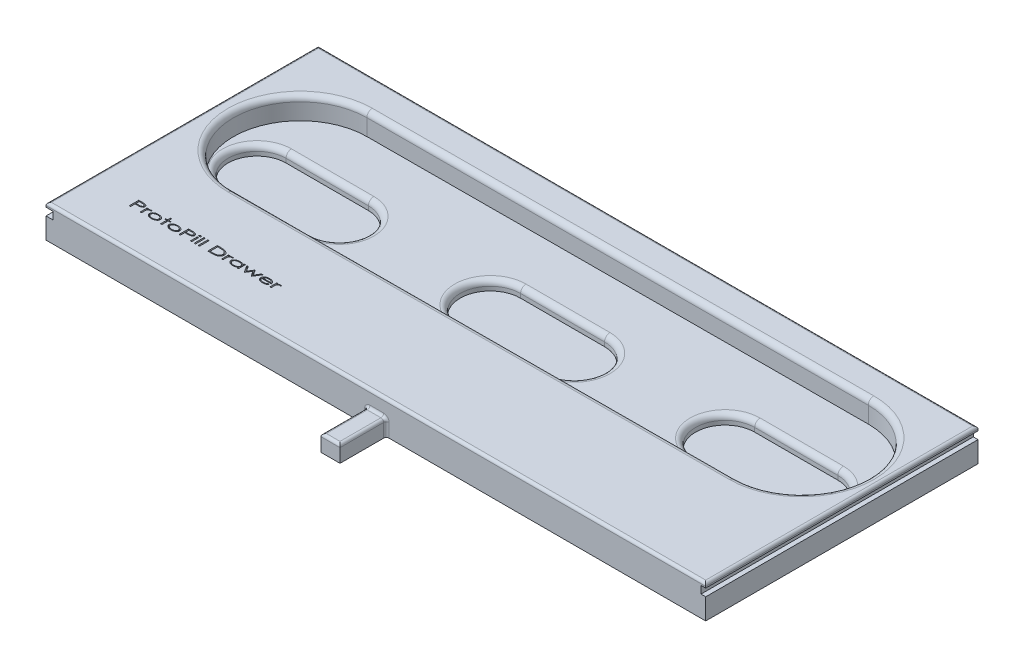
from build123d import *

# Parameters (mm, degrees)
SKETCH1_W           = 242.10193191
SKETCH1_H           = 93
BOSS_EXTRUDE1_DEPTH = 12
SKETCH2_W           = 4.694067914
SKETCH2_H           = 2.762668825
CUT_EXTRUDE1_DEPTH  = 262.694428778
SKETCH7_W           = 6.985929008
SKETCH7_H           = 5.988681595
BOSS_EXTRUDE2_DEPTH = 70
BOSS_EXTRUDE3_DEPTH = 53
CUT_EXTRUDE2_DEPTH  = 8
CUT_EXTRUDE4_DEPTH  = 3.5
FILLET2_R           = 2
FILLET3_R           = 2
SKETCH11_W          = 242.10193191
SKETCH11_H          = 46.073783244
CUT_EXTRUDE5_DEPTH  = 264.63185071
FILLET4_R           = 1
SKETCH12_R          = 3.025
CUT_EXTRUDE6_DEPTH  = 2
SKETCH13_W          = 0.493589743
SKETCH13_H          = 2.557692308
SKETCH13_H_2        = 3.58974359
CUT_EXTRUDE7_DEPTH  = 2
CUT_EXTRUDE8_DEPTH  = 2


with BuildPart() as part:
    # Sketch1 → Boss-Extrude1 (new body)
    with BuildSketch(Plane(origin=(0, 0, 0), x_dir=(1, 0, 0), z_dir=(0, 1, 0))):
        with Locations((123.266397435, 18.180222461)):
            Rectangle(SKETCH1_W, SKETCH1_H)
    extrude(amount=BOSS_EXTRUDE1_DEPTH)

    # Sketch2 → Cut-Extrude1 (cut, through all)
    with BuildSketch(Plane.XY.offset(28.319777539)):
        with Locations((2.347033957, 9.071542246)):
            Rectangle(SKETCH2_W, SKETCH2_H)
    cut_extrude1 = extrude(amount=-CUT_EXTRUDE1_DEPTH, mode=Mode.SUBTRACT)

    # Mirror5: Cut-Extrude1 across plane
    add(cut_extrude1.mirror(Plane(origin=(123.647335387, 0, 0), x_dir=(0, 0, 1), z_dir=(1, 0, 0))), mode=Mode.SUBTRACT)

    # Sketch7 → Boss-Extrude2 (add)
    with BuildSketch(Plane.XY.offset(28.319777539)):
        with Locations((123.619253178, 2.994340798)):
            Rectangle(SKETCH7_W, SKETCH7_H)
    extrude(amount=BOSS_EXTRUDE2_DEPTH)

    # Sketch8 → Boss-Extrude3 (add)
    with BuildSketch(Plane.XY.offset(28.319777539)):
        Polygon((244.31736339, 10.452876658), (244.31736339, 12), (2.21543148, 12), (2.21543148, 10.452876658), (4.694067914, 10.452876658), (4.694067914, 7.690207833), (2.21543148, 7.690207833), (2.21543148, 0), (120.126288674, 0), (120.126288674, 5.988681595), (127.112217682, 5.988681595), (127.112217682, 0), (244.31736339, 0), (244.31736339, 7.690207833), (242.60060286, 7.690207833), (242.60060286, 10.452876658), align=None)
    extrude(amount=BOSS_EXTRUDE3_DEPTH)

    # Sketch9 → Cut-Extrude2 (cut)
    with BuildSketch(Plane(origin=(0, 12, 0), x_dir=(1, 0, 0), z_dir=(0, 1, 0))):
        with BuildLine():
            Line((32.192967626, 6.462131645), (215.586098008, 7.089792499))
            ThreePointArc((215.586098008, 7.089792499), (240.21687673, -17.37296417), (215.754120062, -42.003742891))
            Line((215.754120062, -42.003742891), (32.360989679, -42.631403746))
            ThreePointArc((32.360989679, -42.631403746), (7.730210957, -18.168647077), (32.192967626, 6.462131645))
        make_face()
    extrude(amount=-CUT_EXTRUDE2_DEPTH, mode=Mode.SUBTRACT)

    # Sketch10 → Cut-Extrude4 (cut)
    with BuildSketch(Plane(origin=(0, 4, 0), x_dir=(1, 0, 0), z_dir=(0, 1, 0))):
        with BuildLine():
            Line((22.25591728, -13.271336062), (52.471076918, -13.271336062))
            ThreePointArc((52.471076918, -13.271336062), (63.102678482, -23.902937626), (52.471076918, -34.53453919))
            Line((52.471076918, -34.53453919), (22.25591728, -34.53453919))
            ThreePointArc((22.25591728, -34.53453919), (11.624315716, -23.902937626), (22.25591728, -13.271336062))
        make_face()
        with BuildLine():
            Line((108.253612411, -13.200304135), (139.069681283, -13.200304135))
            ThreePointArc((139.069681283, -13.200304135), (150.155917287, -24.286540139), (139.069681283, -35.372776144))
            Line((139.069681283, -35.372776144), (108.253612411, -35.372776144))
            ThreePointArc((108.253612411, -35.372776144), (97.167376406, -24.286540139), (108.253612411, -13.200304135))
        make_face()
        with BuildLine():
            Line((193.804446674, -12.815543396), (224.338324214, -12.815543396))
            ThreePointArc((224.338324214, -12.815543396), (235.209291929, -23.686511111), (224.338324214, -34.557478826))
            Line((224.338324214, -34.557478826), (193.804446674, -34.557478826))
            ThreePointArc((193.804446674, -34.557478826), (182.933478959, -23.686511111), (193.804446674, -12.815543396))
        make_face()
    extrude(amount=-CUT_EXTRUDE4_DEPTH, mode=Mode.SUBTRACT)

    # Fillet2
    fillet2_edges = [part.edges().sort_by_distance(p)[0] for p in [
        (240.21687673, 12, 17.37296417),
        (124.05755487, 12, 42.317573318),
        (7.730210957, 12, 18.168647077),
        (123.889532817, 12, -6.775962072),
    ]]
    fillet(fillet2_edges, radius=FILLET2_R)

    # Fillet3
    fillet3_edges = [part.edges().sort_by_distance(p)[0] for p in [
        (235.209291929, 4, 23.686511111),
        (209.071385444, 4, 34.557478826),
        (182.933478959, 4, 23.686511111),
        (150.155917287, 4, 24.286540139),
        (123.661646847, 4, 35.372776144),
        (97.167376406, 4, 24.286540139),
        (63.102678482, 4, 23.902937626),
        (37.363497099, 4, 34.53453919),
        (11.624315716, 4, 23.902937626),
        (209.071385444, 4, 12.815543396),
        (123.661646847, 4, 13.200304135),
        (37.363497099, 4, 13.271336062),
    ]]
    fillet(fillet3_edges, radius=FILLET3_R)

    # Sketch11 → Cut-Extrude5 (cut, through all)
    with BuildSketch(Plane(origin=(0, 12, 0), x_dir=(1, 0, 0), z_dir=(0, 1, 0))):
        with Locations((123.266397435, 41.643330839)):
            Rectangle(SKETCH11_W, SKETCH11_H)
    extrude(amount=-CUT_EXTRUDE5_DEPTH, mode=Mode.SUBTRACT)

    # Fillet4
    fillet4_edges = [part.edges().sort_by_distance(p)[0] for p in [
        (120.126288674, 2.994340797, 81.319777539),
        (127.112217682, 2.994340797, 81.319777539),
        (123.619253178, 5.988681595, 98.319777539),
        (120.126288674, 5.988681595, 89.819777539),
        (123.619253178, 5.988681595, 81.319777539),
        (127.112217682, 5.988681595, 89.819777539),
        (244.31736339, 12, 31.356669161),
        (123.266397435, 12, 81.319777539),
        (2.21543148, 12, 31.356669161),
        (123.266397435, 12, -18.606439217),
    ]]
    fillet(fillet4_edges, radius=FILLET4_R)

    # Sketch12 → Cut-Extrude6 (cut)
    with BuildSketch(Plane.XZ):
        with Locations((79.20490952, -2.654606068)):
            Circle(SKETCH12_R)
        with Locations((79.20490952, 6.341887825)):
            Circle(SKETCH12_R)
        with Locations((169.858472383, 5.930696377)):
            Circle(SKETCH12_R)
        with Locations((169.858472383, -2.654606068)):
            Circle(SKETCH12_R)
    extrude(amount=-CUT_EXTRUDE6_DEPTH, mode=Mode.SUBTRACT)

    # Sketch13 → Cut-Extrude7 (cut)
    # profile 1 of 16: a face of its own
    with BuildSketch(Plane(origin=(0, 12, 0), x_dir=(1, 0, 0), z_dir=(0, 1, 0))):
        with BuildLine():
            Line((18.559453652, -63.609154928), (19.589401569, -63.609154928))
            add(Edge.make_bspline(
                [(19.589401569, -63.609154928), (19.660216229, -63.609207816), (19.796009129, -63.609309233), (19.990458636, -63.612311088), (20.166922514, -63.616339403), (20.325381855, -63.621986437), (20.465916911, -63.628417575), (20.588361196, -63.637854069), (20.692806826, -63.647360425), (20.75610385, -63.657252292), (20.784814229, -63.661739063)],
                knots=[0, 0, 0, 0, 1.419177856, 2.721389515, 3.89734153, 4.956527438, 5.899121513, 6.716361902, 7.417765099, 8, 8, 8, 8], degree=3))
            add(Edge.make_bspline(
                [(20.784814229, -63.661739063), (20.820887054, -63.668358554), (20.892034872, -63.681414432), (20.995514197, -63.707401431), (21.093930167, -63.738080351), (21.187023764, -63.77418744), (21.275308065, -63.814482055), (21.358419454, -63.860319671), (21.436467741, -63.910896585), (21.509168984, -63.965877922), (21.575105371, -64.025007934), (21.632608856, -64.088601838), (21.680831646, -64.15611131), (21.721857181, -64.226827444), (21.752422367, -64.301981747), (21.774235543, -64.380809711), (21.788083956, -64.463099368), (21.789502804, -64.519389326), (21.790222883, -64.547957011)],
                knots=[0, 0, 0, 0, 1.202944546, 2.372613736, 3.497786956, 4.582770442, 5.646275108, 6.679186854, 7.693607135, 8.694962411, 9.666642172, 10.595006966, 11.501456956, 12.383984799, 13.271030618, 14.154656858, 15.063470898, 16, 16, 16, 16], degree=3))
            add(Edge.make_bspline(
                [(21.790222883, -64.547957011), (21.789521087, -64.576761689), (21.788143787, -64.633291905), (21.774119081, -64.716000476), (21.752660293, -64.794872573), (21.722045447, -64.869807261), (21.683557714, -64.941214738), (21.635074098, -65.00797268), (21.578906649, -65.07163001), (21.513310562, -65.129978091), (21.440869989, -65.18484635), (21.361600897, -65.235229344), (21.275762005, -65.280811287), (21.183647001, -65.321492741), (21.0849146, -65.357142972), (20.979859337, -65.388653778), (20.867916227, -65.415337146), (20.790732781, -65.429180671), (20.751160383, -65.436278326)],
                knots=[0, 0, 0, 0, 0.922605917, 1.810647271, 2.681294701, 3.538296812, 4.399903948, 5.275180805, 6.177331378, 7.116219832, 8.084190562, 9.088028358, 10.12368074, 11.197019002, 12.313319958, 13.4865942, 14.711362353, 16, 16, 16, 16], degree=3))
            add(Edge.make_bspline(
                [(20.751160383, -65.436278326), (20.718469229, -65.440942875), (20.646706534, -65.451182363), (20.529050496, -65.462594348), (20.392284803, -65.472278622), (20.236346099, -65.479638048), (20.061053197, -65.485869185), (19.866368667, -65.490814558), (19.65227691, -65.493557666), (19.503164369, -65.493697388), (19.425339069, -65.493770313)],
                knots=[0, 0, 0, 0, 0.596701069, 1.309861314, 2.135550679, 3.074303209, 4.130845578, 5.305332262, 6.593590277, 8, 8, 8, 8], degree=3))
            Line((19.425339069, -65.493770313), (19.053043395, -65.493770313))
            Line((19.053043395, -65.493770313), (19.053043395, -67.109154928))
            Line((19.053043395, -67.109154928), (18.559453652, -67.109154928))
            Line((18.559453652, -67.109154928), (18.559453652, -63.609154928))
        make_face()
        with BuildLine():
            Line((19.053043395, -63.968129287), (19.053043395, -65.134795954))
            Line((19.053043395, -65.134795954), (19.953984902, -65.142508294))
            add(Edge.make_bspline(
                [(19.953984902, -65.142508294), (19.99792553, -65.142521334), (20.08301808, -65.142546588), (20.205949603, -65.138570661), (20.319804463, -65.134014923), (20.424328313, -65.127165764), (20.519658494, -65.117805993), (20.606116267, -65.108019692), (20.683188352, -65.094359518), (20.772402579, -65.075649298), (20.871574629, -65.044704061), (20.978955012, -64.998076538), (21.07224247, -64.940131325), (21.152027991, -64.873727987), (21.216190155, -64.800096138), (21.262354089, -64.720428976), (21.291409318, -64.636401283), (21.294894643, -64.578326983), (21.296633139, -64.549359255)],
                knots=[0, 0, 0, 0, 1.302178146, 2.521713123, 3.644833948, 4.679186471, 5.625468095, 6.483724746, 7.256908744, 7.944332482, 9.184328887, 10.328545311, 11.404879146, 12.427406377, 13.395044434, 14.282513672, 15.143309921, 16, 16, 16, 16], degree=3))
            add(Edge.make_bspline(
                [(21.296633139, -64.549359255), (21.29488017, -64.521086999), (21.291349857, -64.464149342), (21.26214629, -64.381617706), (21.216240367, -64.302719484), (21.151826402, -64.230387849), (21.074420468, -64.163622302), (20.983396781, -64.107713567), (20.881682484, -64.060904428), (20.787456502, -64.032245262), (20.703325252, -64.013994903), (20.629883554, -64.00148467), (20.546835613, -63.991071106), (20.454427444, -63.983061843), (20.352767544, -63.975873783), (20.2417168, -63.971162183), (20.121100984, -63.968331153), (20.037420139, -63.968198302), (19.993948844, -63.968129287)],
                knots=[0, 0, 0, 0, 0.85982624, 1.731608922, 2.638175506, 3.627963027, 4.668731374, 5.743984735, 6.872385735, 8.073309669, 8.737023245, 9.49590589, 10.343247817, 11.287432573, 12.322799246, 13.449422509, 14.675002546, 16, 16, 16, 16], degree=3))
            Line((19.993948844, -63.968129287), (19.053043395, -63.968129287))
        make_face(mode=Mode.SUBTRACT)
    # profile 2 of 16: a face of its own
    with BuildSketch(Plane(origin=(0, 12, 0), x_dir=(1, 0, 0), z_dir=(0, 1, 0))):
        with BuildLine():
            Line((22.553043395, -64.55146262), (23.046633139, -64.55146262))
            Line((23.046633139, -64.55146262), (23.046633139, -64.927965024))
            add(Edge.make_bspline(
                [(23.046633139, -64.927965024), (23.082885879, -64.892621444), (23.153638365, -64.823643314), (23.268351063, -64.735386097), (23.385694455, -64.662111951), (23.506193525, -64.604249484), (23.629883275, -64.560946567), (23.755528933, -64.528912548), (23.884155021, -64.510398001), (23.970654507, -64.507865291), (24.014181216, -64.506590826)],
                knots=[0, 0, 0, 0, 1.118950737, 2.183794828, 3.193525129, 4.173720819, 5.133313879, 6.087280825, 7.037516007, 8, 8, 8, 8], degree=3))
            add(Edge.make_bspline(
                [(24.014181216, -64.506590826), (24.047897414, -64.507756469), (24.116628327, -64.510132648), (24.221300531, -64.527311932), (24.329395531, -64.554260942), (24.400953974, -64.580679867), (24.43765878, -64.59423105)],
                knots=[0, 0, 0, 0, 0.930225898, 1.896277749, 2.920927934, 4, 4, 4, 4], degree=3))
            Line((24.43765878, -64.59423105), (24.180347081, -64.866266306))
            add(Edge.make_bspline(
                [(24.180347081, -64.866266306), (24.156566026, -64.8595064), (24.111129946, -64.846590924), (24.045503081, -64.831561132), (23.985450915, -64.822594083), (23.94736645, -64.821303889), (23.929345479, -64.82069339)],
                knots=[0, 0, 0, 0, 1.159041688, 2.214464814, 3.155112748, 4, 4, 4, 4], degree=3))
            add(Edge.make_bspline(
                [(23.929345479, -64.82069339), (23.889948104, -64.822308073), (23.811047254, -64.825541788), (23.694185274, -64.85207983), (23.579705378, -64.894632173), (23.487625223, -64.943250947), (23.416756228, -64.990378929), (23.366448084, -65.031120689), (23.31903889, -65.076135863), (23.275521831, -65.126404123), (23.234924036, -65.180976511), (23.197579829, -65.240229473), (23.163881393, -65.304021263), (23.144708599, -65.348959682), (23.134974485, -65.37177512)],
                knots=[0, 0, 0, 0, 1.378395564, 2.76050325, 4.1743034, 5.645969789, 6.395007641, 7.151651941, 7.909932039, 8.681347296, 9.476827634, 10.289673222, 11.131659355, 12, 12, 12, 12], degree=3))
            add(Edge.make_bspline(
                [(23.134974485, -65.37177512), (23.127503484, -65.391971011), (23.111112, -65.436281085), (23.095135155, -65.512110019), (23.079205605, -65.601073056), (23.068303686, -65.704210737), (23.05820614, -65.820818827), (23.051559556, -65.951306742), (23.047331348, -66.095771336), (23.04687292, -66.196758208), (23.046633139, -66.249579608)],
                knots=[0, 0, 0, 0, 0.582572936, 1.278173338, 2.094113426, 3.030890954, 4.085475449, 5.26463872, 6.569263414, 8, 8, 8, 8], degree=3))
            Line((23.046633139, -66.249579608), (23.046633139, -67.109154928))
            Line((23.046633139, -67.109154928), (22.553043395, -67.109154928))
            Line((22.553043395, -67.109154928), (22.553043395, -64.55146262))
        make_face()
    # profile 3 of 16: a face of its own
    with BuildSketch(Plane(origin=(0, 12, 0), x_dir=(1, 0, 0), z_dir=(0, 1, 0))):
        with BuildLine():
            add(Edge.make_bspline(
                [(26.705787786, -64.506590826), (26.778056125, -64.507620156), (26.919621695, -64.509636499), (27.126898032, -64.530782568), (27.324628677, -64.563483241), (27.513377302, -64.608619596), (27.692408154, -64.66845597), (27.862235557, -64.74094608), (28.023182204, -64.825847595), (28.122431681, -64.894027991), (28.17183346, -64.927965024)],
                knots=[0, 0, 0, 0, 1.118029041, 2.190093497, 3.220499173, 4.217871291, 5.190012594, 6.137901036, 7.073133634, 8, 8, 8, 8], degree=3))
            add(Edge.make_bspline(
                [(28.17183346, -64.927965024), (28.213892898, -64.959851367), (28.295495735, -65.021716578), (28.402860552, -65.125435073), (28.494480251, -65.232803882), (28.5706408, -65.344323998), (28.62815826, -65.461728169), (28.670374378, -65.582809314), (28.695535165, -65.708678755), (28.698822316, -65.794207131), (28.700479293, -65.837319992)],
                knots=[0, 0, 0, 0, 1.156785325, 2.244370538, 3.266277709, 4.248660306, 5.197713603, 6.124949243, 7.054830596, 8, 8, 8, 8], degree=3))
            add(Edge.make_bspline(
                [(28.700479293, -65.837319992), (28.699020086, -65.880703477), (28.696120562, -65.966908882), (28.66788985, -66.09349869), (28.624199892, -66.21614742), (28.562685996, -66.334591252), (28.482768178, -66.448186173), (28.386329221, -66.55792718), (28.271324793, -66.662406192), (28.141405488, -66.762376644), (27.997864786, -66.85478944), (27.842118278, -66.934486584), (27.677093059, -67.00267444), (27.501834157, -67.058149076), (27.316887289, -67.10139543), (27.121923564, -67.13201863), (26.917181777, -67.150431683), (26.777341111, -67.152809862), (26.705787786, -67.154026723)],
                knots=[0, 0, 0, 0, 0.789098804, 1.567983354, 2.350210273, 3.155490411, 3.990287269, 4.874001324, 5.810856407, 6.815460693, 7.856857624, 8.915312001, 9.997439552, 11.105303834, 12.259580059, 13.453399675, 14.696961864, 16, 16, 16, 16], degree=3))
            add(Edge.make_bspline(
                [(26.705787786, -67.154026723), (26.634001021, -67.152802883), (26.493461475, -67.150406928), (26.287787586, -67.132042599), (26.092089603, -67.101519473), (25.90655601, -67.05787591), (25.730646128, -67.002978447), (25.565261375, -66.93445207), (25.409501235, -66.854798449), (25.265964077, -66.762374335), (25.136043872, -66.662406757), (25.021039664, -66.557927043), (24.924600654, -66.448186207), (24.844682849, -66.334591243), (24.783168949, -66.216147422), (24.739478992, -66.093498689), (24.71124828, -65.966908882), (24.708348756, -65.880703477), (24.706889549, -65.837319992)],
                knots=[0, 0, 0, 0, 1.305249044, 2.555333257, 3.751483921, 4.903955647, 6.018189604, 7.098625447, 8.155425126, 9.195194025, 10.198227797, 11.13361828, 12.01595081, 12.849442617, 13.653463848, 14.434467899, 15.212134806, 16, 16, 16, 16], degree=3))
            add(Edge.make_bspline(
                [(24.706889549, -65.837319992), (24.708552832, -65.794438612), (24.711861398, -65.709139906), (24.737074533, -65.583550181), (24.778871813, -65.462378766), (24.837664002, -65.346083449), (24.913193078, -65.234555112), (25.0040698, -65.126875384), (25.112150179, -65.023875406), (25.193526394, -64.962006886), (25.235535383, -64.93006839)],
                knots=[0, 0, 0, 0, 0.94172135, 1.873251586, 2.802131417, 3.750562843, 4.727561346, 5.755201045, 6.841163442, 8, 8, 8, 8], degree=3))
            add(Edge.make_bspline(
                [(25.235535383, -64.93006839), (25.284901741, -64.895839515), (25.383973083, -64.827146974), (25.545486729, -64.742381433), (25.715300151, -64.669073341), (25.89502493, -64.609467936), (26.084251711, -64.563161903), (26.28307383, -64.530923748), (26.491247685, -64.509606196), (26.633283682, -64.507609874), (26.705787786, -64.506590826)],
                knots=[0, 0, 0, 0, 0.925913955, 1.858179155, 2.807793909, 3.776850706, 4.775415181, 5.809663793, 6.881914668, 8, 8, 8, 8], degree=3))
        make_face()
        with BuildLine():
            add(Edge.make_bspline(
                [(26.703684421, -64.82069339), (26.653170058, -64.821651672), (26.553813524, -64.823536516), (26.407422979, -64.837958465), (26.266381666, -64.860892765), (26.13053942, -64.892936964), (26.000513614, -64.935200454), (25.875881416, -64.986660045), (25.756217794, -65.04679942), (25.643966715, -65.116470587), (25.540614354, -65.191698546), (25.450401465, -65.272734905), (25.373244793, -65.356884317), (25.30969161, -65.445275626), (25.26095542, -65.538352301), (25.226535498, -65.63539395), (25.204319933, -65.736059107), (25.201768787, -65.804718817), (25.200479293, -65.839423358)],
                knots=[0, 0, 0, 0, 1.211834855, 2.383553959, 3.525731113, 4.638274302, 5.728838459, 6.802447438, 7.870742288, 8.938271609, 9.968951287, 10.933831991, 11.842871365, 12.70331083, 13.538512719, 14.354385004, 15.168212155, 16, 16, 16, 16], degree=3))
            add(Edge.make_bspline(
                [(25.200479293, -65.839423358), (25.20128811, -65.861880838), (25.202903686, -65.906738615), (25.211779163, -65.973589969), (25.228617652, -66.039026504), (25.249815833, -66.103954003), (25.279245117, -66.166862968), (25.313370433, -66.229252417), (25.355453121, -66.289287174), (25.402115492, -66.348842837), (25.454227927, -66.406224097), (25.512325206, -66.459095498), (25.57354613, -66.510381481), (25.639753494, -66.557531786), (25.710618066, -66.601296414), (25.785477085, -66.641895197), (25.864869786, -66.679042672), (25.977124962, -66.724188783), (26.124887989, -66.770886307), (26.310590114, -66.810534687), (26.504322999, -66.836050577), (26.636529128, -66.838619335), (26.703684421, -66.839924159)],
                knots=[0, 0, 0, 0, 0.676698543, 1.351674039, 2.02606196, 2.70946426, 3.405653627, 4.114679009, 4.848838336, 5.610721482, 6.392982434, 7.180011484, 7.97496537, 8.797371187, 9.625630927, 10.482387151, 11.360987975, 12.264255974, 14.125429088, 16.019773843, 17.978208304, 20, 20, 20, 20], degree=3))
            add(Edge.make_bspline(
                [(26.703684421, -66.839924159), (26.770841079, -66.838623222), (26.903049896, -66.836062115), (27.096763322, -66.810490823), (27.282318068, -66.771090107), (27.429868494, -66.723812046), (27.542331492, -66.679211051), (27.621892969, -66.641887292), (27.696719417, -66.601256356), (27.767572894, -66.557792182), (27.83322779, -66.50991138), (27.895013712, -66.459355254), (27.953174172, -66.406232613), (28.005119145, -66.348566936), (28.052867782, -66.289794691), (28.093633261, -66.22875016), (28.129281063, -66.16732038), (28.157020189, -66.103563808), (28.180038595, -66.039332866), (28.194990878, -65.973378644), (28.205663819, -65.906846209), (28.206480891, -65.861902107), (28.206889549, -65.839423358)],
                knots=[0, 0, 0, 0, 2.021608502, 3.979865511, 5.874038621, 7.728335502, 8.638053201, 9.516574416, 10.373253009, 11.201437702, 12.018055674, 12.818372735, 13.605330473, 14.387520545, 15.15371191, 15.883845854, 16.596257792, 17.289495649, 17.975116066, 18.647787728, 19.323692347, 20, 20, 20, 20], degree=3))
            add(Edge.make_bspline(
                [(28.206889549, -65.839423358), (28.205604326, -65.804716578), (28.203061631, -65.736052439), (28.180783686, -65.63541998), (28.146565943, -65.538150381), (28.09683336, -65.445470458), (28.033463413, -65.356873821), (27.956213394, -65.272527733), (27.865310898, -65.191705357), (27.761397088, -65.116662108), (27.649064475, -65.046774554), (27.529379625, -64.986666237), (27.404752744, -64.935200672), (27.274727078, -64.892929588), (27.139103341, -64.860975962), (26.998549546, -64.837944566), (26.852854913, -64.82353935), (26.753964996, -64.821652671), (26.703684421, -64.82069339)],
                knots=[0, 0, 0, 0, 0.832069071, 1.646171375, 2.462319504, 3.300417048, 4.161147425, 5.070494144, 6.03988092, 7.075430977, 8.143321227, 9.211977265, 10.285949229, 11.376882104, 12.489801441, 13.626829931, 14.793361768, 16, 16, 16, 16], degree=3))
        make_face(mode=Mode.SUBTRACT)
    # profile 4 of 16: a face of its own
    with BuildSketch(Plane(origin=(0, 12, 0), x_dir=(1, 0, 0), z_dir=(0, 1, 0))):
        Polygon((30.046633139, -63.519411338), (30.540222883, -63.519411338), (30.540222883, -64.55146262), (31.303043395, -64.55146262), (31.303043395, -64.865565185), (30.540222883, -64.865565185), (30.540222883, -67.109154928), (30.046633139, -67.109154928), (30.046633139, -64.865565185), (29.373556216, -64.865565185), (29.373556216, -64.55146262), (30.046633139, -64.55146262), align=None)
    # profile 5 of 16: a face of its own
    with BuildSketch(Plane(origin=(0, 12, 0), x_dir=(1, 0, 0), z_dir=(0, 1, 0))):
        with BuildLine():
            add(Edge.make_bspline(
                [(33.840403171, -64.506590826), (33.91267151, -64.507620156), (34.054237079, -64.509636499), (34.261513416, -64.530782568), (34.459244062, -64.563483241), (34.647992687, -64.608619596), (34.827023539, -64.66845597), (34.996850942, -64.74094608), (35.157797589, -64.825847595), (35.257047065, -64.894027991), (35.306448844, -64.927965024)],
                knots=[0, 0, 0, 0, 1.118029041, 2.190093497, 3.220499173, 4.217871291, 5.190012594, 6.137901036, 7.073133634, 8, 8, 8, 8], degree=3))
            add(Edge.make_bspline(
                [(35.306448844, -64.927965024), (35.348508282, -64.959851367), (35.430111119, -65.021716578), (35.537475937, -65.125435073), (35.629095636, -65.232803882), (35.705256185, -65.344323998), (35.762773644, -65.461728169), (35.804989762, -65.582809314), (35.83015055, -65.708678755), (35.833437701, -65.794207131), (35.835094678, -65.837319992)],
                knots=[0, 0, 0, 0, 1.156785325, 2.244370538, 3.266277709, 4.248660306, 5.197713603, 6.124949243, 7.054830596, 8, 8, 8, 8], degree=3))
            add(Edge.make_bspline(
                [(35.835094678, -65.837319992), (35.833635471, -65.880703477), (35.830735946, -65.966908882), (35.802505235, -66.09349869), (35.758815277, -66.21614742), (35.697301381, -66.334591252), (35.617383562, -66.448186173), (35.520944606, -66.55792718), (35.405940177, -66.662406192), (35.276020873, -66.762376644), (35.13248017, -66.85478944), (34.976733663, -66.934486584), (34.811708444, -67.00267444), (34.636449541, -67.058149076), (34.451502674, -67.10139543), (34.256538949, -67.13201863), (34.051797161, -67.150431683), (33.911956496, -67.152809862), (33.840403171, -67.154026723)],
                knots=[0, 0, 0, 0, 0.789098804, 1.567983354, 2.350210273, 3.155490411, 3.990287269, 4.874001324, 5.810856407, 6.815460693, 7.856857624, 8.915312001, 9.997439552, 11.105303834, 12.259580059, 13.453399675, 14.696961864, 16, 16, 16, 16], degree=3))
            add(Edge.make_bspline(
                [(33.840403171, -67.154026723), (33.768616406, -67.152802883), (33.62807686, -67.150406928), (33.422402971, -67.132042599), (33.226704988, -67.101519473), (33.041171394, -67.05787591), (32.865261513, -67.002978447), (32.699876759, -66.93445207), (32.544116619, -66.854798449), (32.400579462, -66.762374335), (32.270659257, -66.662406757), (32.155655049, -66.557927043), (32.059216039, -66.448186207), (31.979298233, -66.334591243), (31.917784334, -66.216147422), (31.874094377, -66.093498689), (31.845863665, -65.966908882), (31.84296414, -65.880703477), (31.841504934, -65.837319992)],
                knots=[0, 0, 0, 0, 1.305249044, 2.555333257, 3.751483921, 4.903955647, 6.018189604, 7.098625447, 8.155425126, 9.195194025, 10.198227797, 11.13361828, 12.01595081, 12.849442617, 13.653463848, 14.434467899, 15.212134806, 16, 16, 16, 16], degree=3))
            add(Edge.make_bspline(
                [(31.841504934, -65.837319992), (31.843168217, -65.794438612), (31.846476782, -65.709139906), (31.871689918, -65.583550181), (31.913487198, -65.462378766), (31.972279386, -65.346083449), (32.047808463, -65.234555112), (32.138685185, -65.126875384), (32.246765564, -65.023875406), (32.328141779, -64.962006886), (32.370150767, -64.93006839)],
                knots=[0, 0, 0, 0, 0.94172135, 1.873251586, 2.802131417, 3.750562843, 4.727561346, 5.755201045, 6.841163442, 8, 8, 8, 8], degree=3))
            add(Edge.make_bspline(
                [(32.370150767, -64.93006839), (32.419517126, -64.895839515), (32.518588467, -64.827146974), (32.680102113, -64.742381433), (32.849915535, -64.669073341), (33.029640315, -64.609467936), (33.218867096, -64.563161903), (33.417689214, -64.530923748), (33.62586307, -64.509606196), (33.767899067, -64.507609874), (33.840403171, -64.506590826)],
                knots=[0, 0, 0, 0, 0.925913955, 1.858179155, 2.807793909, 3.776850706, 4.775415181, 5.809663793, 6.881914668, 8, 8, 8, 8], degree=3))
        make_face()
        with BuildLine():
            add(Edge.make_bspline(
                [(33.838299806, -64.82069339), (33.787785443, -64.821651672), (33.688428909, -64.823536516), (33.542038364, -64.837958465), (33.400997051, -64.860892765), (33.265154804, -64.892936964), (33.135128999, -64.935200454), (33.010496801, -64.986660045), (32.890833179, -65.04679942), (32.7785821, -65.116470587), (32.675229739, -65.191698546), (32.585016849, -65.272734905), (32.507860177, -65.356884317), (32.444306995, -65.445275626), (32.395570804, -65.538352301), (32.361150883, -65.63539395), (32.338935317, -65.736059107), (32.336384172, -65.804718817), (32.335094678, -65.839423358)],
                knots=[0, 0, 0, 0, 1.211834855, 2.383553959, 3.525731113, 4.638274302, 5.728838459, 6.802447438, 7.870742288, 8.938271609, 9.968951287, 10.933831991, 11.842871365, 12.70331083, 13.538512719, 14.354385004, 15.168212155, 16, 16, 16, 16], degree=3))
            add(Edge.make_bspline(
                [(32.335094678, -65.839423358), (32.335903495, -65.861880838), (32.337519071, -65.906738615), (32.346394547, -65.973589969), (32.363233036, -66.039026504), (32.384431218, -66.103954003), (32.413860502, -66.166862968), (32.447985817, -66.229252417), (32.490068505, -66.289287174), (32.536730877, -66.348842837), (32.588843311, -66.406224097), (32.646940591, -66.459095498), (32.708161514, -66.510381481), (32.774368878, -66.557531786), (32.84523345, -66.601296414), (32.920092469, -66.641895197), (32.999485171, -66.679042672), (33.111740347, -66.724188783), (33.259503373, -66.770886307), (33.445205499, -66.810534687), (33.638938383, -66.836050577), (33.771144513, -66.838619335), (33.838299806, -66.839924159)],
                knots=[0, 0, 0, 0, 0.676698543, 1.351674039, 2.02606196, 2.70946426, 3.405653627, 4.114679009, 4.848838336, 5.610721482, 6.392982434, 7.180011484, 7.97496537, 8.797371187, 9.625630927, 10.482387151, 11.360987975, 12.264255974, 14.125429088, 16.019773843, 17.978208304, 20, 20, 20, 20], degree=3))
            add(Edge.make_bspline(
                [(33.838299806, -66.839924159), (33.905456464, -66.838623222), (34.03766528, -66.836062115), (34.231378706, -66.810490823), (34.416933453, -66.771090107), (34.564483879, -66.723812046), (34.676946876, -66.679211051), (34.756508354, -66.641887292), (34.831334801, -66.601256356), (34.902188279, -66.557792182), (34.967843174, -66.50991138), (35.029629097, -66.459355254), (35.087789556, -66.406232613), (35.13973453, -66.348566936), (35.187483167, -66.289794691), (35.228248646, -66.22875016), (35.263896448, -66.16732038), (35.291635574, -66.103563808), (35.314653979, -66.039332866), (35.329606263, -65.973378644), (35.340279203, -65.906846209), (35.341096276, -65.861902107), (35.341504934, -65.839423358)],
                knots=[0, 0, 0, 0, 2.021608502, 3.979865511, 5.874038621, 7.728335502, 8.638053201, 9.516574416, 10.373253009, 11.201437702, 12.018055674, 12.818372735, 13.605330473, 14.387520545, 15.15371191, 15.883845854, 16.596257792, 17.289495649, 17.975116066, 18.647787728, 19.323692347, 20, 20, 20, 20], degree=3))
            add(Edge.make_bspline(
                [(35.341504934, -65.839423358), (35.340219711, -65.804716578), (35.337677016, -65.736052439), (35.31539907, -65.63541998), (35.281181328, -65.538150381), (35.231448744, -65.445470458), (35.168078797, -65.356873821), (35.090828779, -65.272527733), (34.999926282, -65.191705357), (34.896012472, -65.116662108), (34.78367986, -65.046774554), (34.663995009, -64.986666237), (34.539368128, -64.935200672), (34.409342463, -64.892929588), (34.273718725, -64.860975962), (34.133164931, -64.837944566), (33.987470297, -64.82353935), (33.88858038, -64.821652671), (33.838299806, -64.82069339)],
                knots=[0, 0, 0, 0, 0.832069071, 1.646171375, 2.462319504, 3.300417048, 4.161147425, 5.070494144, 6.03988092, 7.075430977, 8.143321227, 9.211977265, 10.285949229, 11.376882104, 12.489801441, 13.626829931, 14.793361768, 16, 16, 16, 16], degree=3))
        make_face(mode=Mode.SUBTRACT)
    # profile 6 of 16: a face of its own
    with BuildSketch(Plane(origin=(0, 12, 0), x_dir=(1, 0, 0), z_dir=(0, 1, 0))):
        with BuildLine():
            Line((36.822274165, -63.609154928), (37.852222081, -63.609154928))
            add(Edge.make_bspline(
                [(37.852222081, -63.609154928), (37.923036742, -63.609207816), (38.058829642, -63.609309233), (38.253279149, -63.612311088), (38.429743027, -63.616339403), (38.588202368, -63.621986437), (38.728737424, -63.628417575), (38.851181709, -63.637854069), (38.955627339, -63.647360425), (39.018924363, -63.657252292), (39.047634742, -63.661739063)],
                knots=[0, 0, 0, 0, 1.419177856, 2.721389515, 3.89734153, 4.956527438, 5.899121513, 6.716361902, 7.417765099, 8, 8, 8, 8], degree=3))
            add(Edge.make_bspline(
                [(39.047634742, -63.661739063), (39.083707567, -63.668358554), (39.154855385, -63.681414432), (39.25833471, -63.707401431), (39.35675068, -63.738080351), (39.449844277, -63.77418744), (39.538128578, -63.814482055), (39.621239966, -63.860319671), (39.699288254, -63.910896585), (39.771989497, -63.965877922), (39.837925884, -64.025007934), (39.895429369, -64.088601838), (39.943652158, -64.15611131), (39.984677694, -64.226827444), (40.01524288, -64.301981747), (40.037056055, -64.380809711), (40.050904469, -64.463099368), (40.052323317, -64.519389326), (40.053043395, -64.547957011)],
                knots=[0, 0, 0, 0, 1.202944546, 2.372613736, 3.497786956, 4.582770442, 5.646275108, 6.679186854, 7.693607135, 8.694962411, 9.666642172, 10.595006966, 11.501456956, 12.383984799, 13.271030618, 14.154656858, 15.063470898, 16, 16, 16, 16], degree=3))
            add(Edge.make_bspline(
                [(40.053043395, -64.547957011), (40.0523416, -64.576761689), (40.0509643, -64.633291905), (40.036939593, -64.716000476), (40.015480806, -64.794872573), (39.984865959, -64.869807261), (39.946378227, -64.941214738), (39.897894611, -65.00797268), (39.841727161, -65.07163001), (39.776131075, -65.129978091), (39.703690502, -65.18484635), (39.62442141, -65.235229344), (39.538582518, -65.280811287), (39.446467514, -65.321492741), (39.347735113, -65.357142972), (39.24267985, -65.388653778), (39.130736739, -65.415337146), (39.053553293, -65.429180671), (39.013980895, -65.436278326)],
                knots=[0, 0, 0, 0, 0.922605917, 1.810647271, 2.681294701, 3.538296812, 4.399903948, 5.275180805, 6.177331378, 7.116219832, 8.084190562, 9.088028358, 10.12368074, 11.197019002, 12.313319958, 13.4865942, 14.711362353, 16, 16, 16, 16], degree=3))
            add(Edge.make_bspline(
                [(39.013980895, -65.436278326), (38.981289742, -65.440942875), (38.909527047, -65.451182363), (38.791871009, -65.462594348), (38.655105316, -65.472278622), (38.499166612, -65.479638048), (38.32387371, -65.485869185), (38.12918918, -65.490814558), (37.915097422, -65.493557666), (37.765984882, -65.493697388), (37.688159581, -65.493770313)],
                knots=[0, 0, 0, 0, 0.596701069, 1.309861314, 2.135550679, 3.074303209, 4.130845578, 5.305332262, 6.593590277, 8, 8, 8, 8], degree=3))
            Line((37.688159581, -65.493770313), (37.315863908, -65.493770313))
            Line((37.315863908, -65.493770313), (37.315863908, -67.109154928))
            Line((37.315863908, -67.109154928), (36.822274165, -67.109154928))
            Line((36.822274165, -67.109154928), (36.822274165, -63.609154928))
        make_face()
        with BuildLine():
            Line((37.315863908, -63.968129287), (37.315863908, -65.134795954))
            Line((37.315863908, -65.134795954), (38.216805415, -65.142508294))
            add(Edge.make_bspline(
                [(38.216805415, -65.142508294), (38.260746043, -65.142521334), (38.345838593, -65.142546588), (38.468770116, -65.138570661), (38.582624975, -65.134014923), (38.687148826, -65.127165764), (38.782479007, -65.117805993), (38.86893678, -65.108019692), (38.946008865, -65.094359518), (39.035223092, -65.075649298), (39.134395142, -65.044704061), (39.241775524, -64.998076538), (39.335062983, -64.940131325), (39.414848504, -64.873727987), (39.479010668, -64.800096138), (39.525174602, -64.720428976), (39.554229831, -64.636401283), (39.557715156, -64.578326983), (39.559453652, -64.549359255)],
                knots=[0, 0, 0, 0, 1.302178146, 2.521713123, 3.644833948, 4.679186471, 5.625468095, 6.483724746, 7.256908744, 7.944332482, 9.184328887, 10.328545311, 11.404879146, 12.427406377, 13.395044434, 14.282513672, 15.143309921, 16, 16, 16, 16], degree=3))
            add(Edge.make_bspline(
                [(39.559453652, -64.549359255), (39.557700683, -64.521086999), (39.554170369, -64.464149342), (39.524966803, -64.381617706), (39.47906088, -64.302719484), (39.414646915, -64.230387849), (39.337240981, -64.163622302), (39.246217293, -64.107713567), (39.144502997, -64.060904428), (39.050277015, -64.032245262), (38.966145765, -64.013994903), (38.892704067, -64.00148467), (38.809656126, -63.991071106), (38.717247957, -63.983061843), (38.615588056, -63.975873783), (38.504537313, -63.971162183), (38.383921497, -63.968331153), (38.300240652, -63.968198302), (38.256769357, -63.968129287)],
                knots=[0, 0, 0, 0, 0.85982624, 1.731608922, 2.638175506, 3.627963027, 4.668731374, 5.743984735, 6.872385735, 8.073309669, 8.737023245, 9.49590589, 10.343247817, 11.287432573, 12.322799246, 13.449422509, 14.675002546, 16, 16, 16, 16], degree=3))
            Line((38.256769357, -63.968129287), (37.315863908, -63.968129287))
        make_face(mode=Mode.SUBTRACT)
    # profile 7 of 16: a face of its own
    with BuildSketch(Plane(origin=(0, 12, 0), x_dir=(1, 0, 0), z_dir=(0, 1, 0))):
        with BuildLine():
            add(Edge.make_bspline(
                [(41.195170799, -63.474539544), (41.223742293, -63.475444808), (41.279186456, -63.47720151), (41.359164795, -63.491819245), (41.432178837, -63.517540909), (41.497355041, -63.551134641), (41.552523123, -63.591527922), (41.592788877, -63.638471284), (41.619361021, -63.690084533), (41.622163424, -63.7268835), (41.623556216, -63.745172556)],
                knots=[0, 0, 0, 0, 1.232622349, 2.391954591, 3.492533549, 4.561789548, 5.54829387, 6.421376584, 7.215425493, 8, 8, 8, 8], degree=3))
            add(Edge.make_bspline(
                [(41.623556216, -63.745172556), (41.622129336, -63.762989159), (41.619237592, -63.79909666), (41.592764511, -63.849828547), (41.552271135, -63.896017197), (41.497388245, -63.936437233), (41.43216936, -63.969990798), (41.359167501, -63.995723927), (41.279185714, -64.010338417), (41.22374204, -64.01209558), (41.195170799, -64.013001082)],
                knots=[0, 0, 0, 0, 0.768134372, 1.55671721, 2.426123539, 3.417176527, 4.491362752, 5.597016362, 6.761694161, 8, 8, 8, 8], degree=3))
            add(Edge.make_bspline(
                [(41.195170799, -64.013001082), (41.167299701, -64.012088189), (41.113015682, -64.010310165), (41.034441435, -63.995641492), (40.962203204, -63.969837117), (40.897154989, -63.936450047), (40.842278337, -63.896014323), (40.80178356, -63.849829196), (40.775310798, -63.799096509), (40.772419013, -63.762989109), (40.770992113, -63.745172556)],
                knots=[0, 0, 0, 0, 1.217058856, 2.370442829, 3.474794704, 4.557074952, 5.555595552, 6.431552882, 7.226077714, 8, 8, 8, 8], degree=3))
            add(Edge.make_bspline(
                [(40.770992113, -63.745172556), (40.772384926, -63.726883552), (40.77518737, -63.690084689), (40.801759191, -63.638470624), (40.842026358, -63.59153082), (40.897188205, -63.551121842), (40.962193812, -63.517694669), (41.034444082, -63.491901625), (41.113014965, -63.477229785), (41.167299458, -63.475452207), (41.195170799, -63.474539544)],
                knots=[0, 0, 0, 0, 0.790458961, 1.590463383, 2.470094379, 3.463997666, 4.541273283, 5.640518464, 6.788569012, 8, 8, 8, 8], degree=3))
        make_face()
    # profile 8 of 16: a face of its own
    with BuildSketch(Plane(origin=(0, 12, 0), x_dir=(1, 0, 0), z_dir=(0, 1, 0))):
        with Locations((41.197274165, -65.830308774)):
            Rectangle(SKETCH13_W, SKETCH13_H)
    # profile 9 of 16: a face of its own
    with BuildSketch(Plane(origin=(0, 12, 0), x_dir=(1, 0, 0), z_dir=(0, 1, 0))):
        with Locations((42.633171601, -65.314283133)):
            Rectangle(SKETCH13_W, SKETCH13_H_2)
    # profile 10 of 16: a face of its own
    with BuildSketch(Plane(origin=(0, 12, 0), x_dir=(1, 0, 0), z_dir=(0, 1, 0))):
        with Locations((44.069069037, -65.314283133)):
            Rectangle(SKETCH13_W, SKETCH13_H_2)
    # profile 11 of 16: a face of its own
    with BuildSketch(Plane(origin=(0, 12, 0), x_dir=(1, 0, 0), z_dir=(0, 1, 0))):
        with BuildLine():
            Line((47.36714596, -67.109154928), (47.36714596, -63.609154928))
            Line((47.36714596, -63.609154928), (48.438460062, -63.609154928))
            add(Edge.make_bspline(
                [(48.438460062, -63.609154928), (48.531712009, -63.609594491), (48.711689613, -63.610442853), (48.971851243, -63.615895212), (49.212171661, -63.625396635), (49.432590558, -63.639513457), (49.633032827, -63.656451712), (49.813573226, -63.678081235), (49.974404016, -63.703247199), (50.074263118, -63.725097127), (50.12115237, -63.735356851)],
                knots=[0, 0, 0, 0, 1.323813521, 2.554979188, 3.693909684, 4.737789415, 5.690279757, 6.54911815, 7.318732465, 8, 8, 8, 8], degree=3))
            add(Edge.make_bspline(
                [(50.12115237, -63.735356851), (50.182360785, -63.750727059), (50.302289439, -63.780842662), (50.47510584, -63.837934848), (50.63743565, -63.903410911), (50.790380521, -63.975703775), (50.931875258, -64.058538865), (51.064820416, -64.147100164), (51.186111181, -64.245737983), (51.297114502, -64.351616929), (51.396649223, -64.463823474), (51.482778392, -64.582568992), (51.556053676, -64.706153808), (51.616102467, -64.835272179), (51.66268865, -64.96989436), (51.695126289, -65.109985297), (51.716599116, -65.254959753), (51.718664648, -65.353468165), (51.719710062, -65.403325601)],
                knots=[0, 0, 0, 0, 1.207798654, 2.366499211, 3.480576359, 4.557146755, 5.601517647, 6.616536575, 7.612203728, 8.589979544, 9.55040618, 10.479294148, 11.393893687, 12.296620384, 13.200709655, 14.115506133, 15.04621312, 16, 16, 16, 16], degree=3))
            add(Edge.make_bspline(
                [(51.719710062, -65.403325601), (51.71893028, -65.44662001), (51.717390347, -65.532118874), (51.70024112, -65.657973096), (51.674873544, -65.780195858), (51.637216344, -65.898018322), (51.590084674, -66.012342778), (51.53255743, -66.122909801), (51.463341196, -66.228750322), (51.38472431, -66.330215054), (51.298266291, -66.426557074), (51.204295017, -66.516438037), (51.105296567, -66.600746353), (50.998948774, -66.677434843), (50.887067496, -66.74843722), (50.768192025, -66.811937669), (50.643543087, -66.869819765), (50.511351032, -66.921417693), (50.369248869, -66.966514904), (50.214925451, -67.005008441), (50.047228204, -67.036725523), (49.865936723, -67.063218635), (49.671362091, -67.084174925), (49.463202803, -67.098401362), (49.241800204, -67.107872409), (49.089579057, -67.108719292), (49.011276569, -67.109154928)],
                knots=[0, 0, 0, 0, 0.867583375, 1.713324997, 2.542387203, 3.367932116, 4.189477015, 5.019531976, 5.863128609, 6.721742731, 7.591172003, 8.456207664, 9.327453716, 10.196390289, 11.083089667, 11.982588127, 12.896750361, 13.837492442, 14.826032314, 15.884199514, 17.024778466, 18.246884326, 19.557235698, 20.947863052, 22.429982155, 24, 24, 24, 24], degree=3))
            Line((49.011276569, -67.109154928), (47.36714596, -67.109154928))
        make_face()
        with BuildLine():
            Line((47.860735703, -66.750180569), (48.463700447, -66.750180569))
            add(Edge.make_bspline(
                [(48.463700447, -66.750180569), (48.550407656, -66.749934964), (48.716821888, -66.749463582), (48.95616186, -66.745259824), (49.174708879, -66.738427089), (49.37271188, -66.728874591), (49.549883598, -66.71619384), (49.706396613, -66.702106612), (49.842167294, -66.684499735), (49.925133013, -66.668512174), (49.963399966, -66.661138101)],
                knots=[0, 0, 0, 0, 1.383279688, 2.654882197, 3.818759855, 4.871481191, 5.817166586, 6.652292251, 7.378385793, 8, 8, 8, 8], degree=3))
            add(Edge.make_bspline(
                [(49.963399966, -66.661138101), (50.011186753, -66.649900503), (50.105041787, -66.62782944), (50.241009103, -66.587803159), (50.36838981, -66.539255854), (50.488739138, -66.486822737), (50.600589123, -66.425799165), (50.70498325, -66.359779234), (50.801333549, -66.286791684), (50.889427588, -66.207922208), (50.968761515, -66.123588853), (51.03706997, -66.033750412), (51.095875592, -65.940178438), (51.144034391, -65.841593247), (51.180096557, -65.737828321), (51.207238232, -65.63024341), (51.222644147, -65.51781855), (51.224948247, -65.441464821), (51.226120319, -65.402624479)],
                knots=[0, 0, 0, 0, 1.213921113, 2.384186417, 3.50166985, 4.583183161, 5.627935832, 6.649229357, 7.63522774, 8.613403315, 9.570260051, 10.49386413, 11.399942308, 12.29947164, 13.200651912, 14.111784984, 15.039484809, 16, 16, 16, 16], degree=3))
            add(Edge.make_bspline(
                [(51.226120319, -65.402624479), (51.225164489, -65.361653507), (51.223281928, -65.280958781), (51.204746311, -65.162709599), (51.177133933, -65.048797063), (51.136823711, -64.939456945), (51.084560482, -64.834968598), (51.021777525, -64.734416325), (50.947039959, -64.639039909), (50.861283864, -64.54852776), (50.765322475, -64.46414008), (50.660407906, -64.385833697), (50.546112391, -64.315173186), (50.423418459, -64.250271267), (50.290797228, -64.193980968), (50.149854108, -64.143152042), (49.999496542, -64.100679796), (49.89575075, -64.077907524), (49.842807017, -64.066286338)],
                knots=[0, 0, 0, 0, 0.937479559, 1.846420823, 2.734195072, 3.61797647, 4.508263293, 5.405088182, 6.327834881, 7.277997599, 8.256154844, 9.250457072, 10.272077141, 11.330106498, 12.425583743, 13.568150063, 14.758974123, 16, 16, 16, 16], degree=3))
            add(Edge.make_bspline(
                [(49.842807017, -64.066286338), (49.798702837, -64.058152015), (49.704301647, -64.040741196), (49.551849118, -64.022169849), (49.38002734, -64.005402586), (49.18833763, -63.991414461), (48.976757528, -63.981340846), (48.74536129, -63.973768644), (48.494105175, -63.968655685), (48.319973182, -63.968309238), (48.229525767, -63.968129287)],
                knots=[0, 0, 0, 0, 0.664968389, 1.423307427, 2.276521454, 3.225252385, 4.273249474, 5.41763715, 6.658672415, 8, 8, 8, 8], degree=3))
            Line((48.229525767, -63.968129287), (47.860735703, -63.968129287))
            Line((47.860735703, -63.968129287), (47.860735703, -66.750180569))
        make_face(mode=Mode.SUBTRACT)
    # profile 12 of 16: a face of its own
    with BuildSketch(Plane(origin=(0, 12, 0), x_dir=(1, 0, 0), z_dir=(0, 1, 0))):
        with BuildLine():
            Line((52.43765878, -64.55146262), (52.931248524, -64.55146262))
            Line((52.931248524, -64.55146262), (52.931248524, -64.927965024))
            add(Edge.make_bspline(
                [(52.931248524, -64.927965024), (52.967501264, -64.892621444), (53.03825375, -64.823643314), (53.152966447, -64.735386097), (53.270309839, -64.662111951), (53.39080891, -64.604249484), (53.51449866, -64.560946567), (53.640144318, -64.528912548), (53.768770406, -64.510398001), (53.855269892, -64.507865291), (53.898796601, -64.506590826)],
                knots=[0, 0, 0, 0, 1.118950737, 2.183794828, 3.193525129, 4.173720819, 5.133313879, 6.087280825, 7.037516007, 8, 8, 8, 8], degree=3))
            add(Edge.make_bspline(
                [(53.898796601, -64.506590826), (53.932512798, -64.507756469), (54.001243711, -64.510132648), (54.105915916, -64.527311932), (54.214010916, -64.554260942), (54.285569359, -64.580679867), (54.322274165, -64.59423105)],
                knots=[0, 0, 0, 0, 0.930225898, 1.896277749, 2.920927934, 4, 4, 4, 4], degree=3))
            Line((54.322274165, -64.59423105), (54.064962466, -64.866266306))
            add(Edge.make_bspline(
                [(54.064962466, -64.866266306), (54.04118141, -64.8595064), (53.99574533, -64.846590924), (53.930118466, -64.831561132), (53.8700663, -64.822594083), (53.831981835, -64.821303889), (53.813960863, -64.82069339)],
                knots=[0, 0, 0, 0, 1.159041688, 2.214464814, 3.155112748, 4, 4, 4, 4], degree=3))
            add(Edge.make_bspline(
                [(53.813960863, -64.82069339), (53.774563489, -64.822308073), (53.695662639, -64.825541788), (53.578800659, -64.85207983), (53.464320762, -64.894632173), (53.372240607, -64.943250947), (53.301371612, -64.990378929), (53.251063469, -65.031120689), (53.203654275, -65.076135863), (53.160137216, -65.126404123), (53.119539421, -65.180976511), (53.082195214, -65.240229473), (53.048496778, -65.304021263), (53.029323984, -65.348959682), (53.01958987, -65.37177512)],
                knots=[0, 0, 0, 0, 1.378395564, 2.76050325, 4.1743034, 5.645969789, 6.395007641, 7.151651941, 7.909932039, 8.681347296, 9.476827634, 10.289673222, 11.131659355, 12, 12, 12, 12], degree=3))
            add(Edge.make_bspline(
                [(53.01958987, -65.37177512), (53.012118868, -65.391971011), (52.995727384, -65.436281085), (52.97975054, -65.512110019), (52.963820989, -65.601073056), (52.952919071, -65.704210737), (52.942821525, -65.820818827), (52.936174941, -65.951306742), (52.931946732, -66.095771336), (52.931488305, -66.196758208), (52.931248524, -66.249579608)],
                knots=[0, 0, 0, 0, 0.582572936, 1.278173338, 2.094113426, 3.030890954, 4.085475449, 5.26463872, 6.569263414, 8, 8, 8, 8], degree=3))
            Line((52.931248524, -66.249579608), (52.931248524, -67.109154928))
            Line((52.931248524, -67.109154928), (52.43765878, -67.109154928))
            Line((52.43765878, -67.109154928), (52.43765878, -64.55146262))
        make_face()
    # profile 13 of 16: a face of its own
    with BuildSketch(Plane(origin=(0, 12, 0), x_dir=(1, 0, 0), z_dir=(0, 1, 0))):
        with BuildLine():
            Line((58.629966472, -64.55146262), (58.629966472, -67.109154928))
            Line((58.629966472, -67.109154928), (58.136376729, -67.109154928))
            Line((58.136376729, -67.109154928), (58.136376729, -66.666747076))
            add(Edge.make_bspline(
                [(58.136376729, -66.666747076), (58.083405025, -66.707144972), (57.977740519, -66.787728067), (57.80516538, -66.888334084), (57.623576286, -66.973052459), (57.432019869, -67.040222741), (57.23150627, -67.091139072), (57.022160476, -67.127216323), (56.803840868, -67.150570325), (56.654967572, -67.152860788), (56.579185222, -67.154026723)],
                knots=[0, 0, 0, 0, 0.959950057, 1.9148459, 2.87384884, 3.846004085, 4.837560737, 5.853778905, 6.907489231, 8, 8, 8, 8], degree=3))
            add(Edge.make_bspline(
                [(56.579185222, -67.154026723), (56.511834357, -67.15281249), (56.379452071, -67.150425841), (56.184595544, -67.131673367), (55.997367817, -67.101949123), (55.817336407, -67.059734305), (55.644987842, -67.005276263), (55.480074165, -66.9381943), (55.322411488, -66.859814105), (55.174528406, -66.769213218), (55.038813222, -66.671014904), (54.919093167, -66.566671181), (54.818569116, -66.455680116), (54.735700408, -66.339672541), (54.671016296, -66.218093368), (54.625010515, -66.09118191), (54.596619229, -65.95893555), (54.593219728, -65.868776207), (54.591504934, -65.823297556)],
                knots=[0, 0, 0, 0, 1.226021397, 2.409820796, 3.560528837, 4.675169253, 5.773241012, 6.84782229, 7.91342823, 8.975196037, 10.001589918, 10.960246305, 11.860978357, 12.721634312, 13.549600474, 14.359895992, 15.172690086, 16, 16, 16, 16], degree=3))
            add(Edge.make_bspline(
                [(54.591504934, -65.823297556), (54.593250564, -65.77875867), (54.596720224, -65.690232002), (54.624839457, -65.560131313), (54.671970306, -65.435271195), (54.737055308, -65.315614638), (54.820162251, -65.200830653), (54.922486921, -65.091848358), (55.042735011, -64.987633697), (55.179593468, -64.889779885), (55.32894941, -64.80019106), (55.487797498, -64.721723646), (55.653795233, -64.654555584), (55.827808982, -64.60104822), (56.008748713, -64.55793434), (56.197417144, -64.528002604), (56.393285918, -64.510456485), (56.526331604, -64.507892922), (56.59390878, -64.506590826)],
                knots=[0, 0, 0, 0, 0.810112008, 1.610200051, 2.409779071, 3.23202922, 4.082076825, 4.982045036, 5.946842608, 6.973913408, 8.040473165, 9.113409892, 10.195590852, 11.296150651, 12.423889662, 13.578489405, 14.770055223, 16, 16, 16, 16], degree=3))
            add(Edge.make_bspline(
                [(56.59390878, -64.506590826), (56.671553579, -64.508040068), (56.823694877, -64.510879789), (57.04602767, -64.534002364), (57.256890349, -64.573565992), (57.424657527, -64.618589097), (57.552918238, -64.662502718), (57.645129823, -64.70052421), (57.734240862, -64.743688682), (57.820961072, -64.790064138), (57.904322652, -64.841912414), (57.984944422, -64.897910003), (58.062794342, -64.958645051), (58.111850294, -65.002695828), (58.136376729, -65.024719832)],
                knots=[0, 0, 0, 0, 1.676518641, 3.285058718, 4.820346399, 6.305438499, 7.031660956, 7.746785142, 8.457855071, 9.169193615, 9.869488998, 10.576517448, 11.288303459, 12, 12, 12, 12], degree=3))
            Line((58.136376729, -65.024719832), (58.136376729, -64.55146262))
            Line((58.136376729, -64.55146262), (58.629966472, -64.55146262))
        make_face()
        with BuildLine():
            add(Edge.make_bspline(
                [(56.612839069, -64.82069339), (56.54522419, -64.822321038), (56.412111003, -64.825525385), (56.216342831, -64.850522536), (56.028387984, -64.891868097), (55.878199338, -64.939962954), (55.763663038, -64.985602899), (55.682751928, -65.023700461), (55.606230752, -65.064798365), (55.534665585, -65.11002267), (55.466996408, -65.157661521), (55.403774714, -65.208736038), (55.345417031, -65.263785808), (55.291625533, -65.321524741), (55.243692312, -65.381527442), (55.201048158, -65.442114807), (55.164850461, -65.503812834), (55.136655089, -65.567185612), (55.112641083, -65.630551755), (55.096629327, -65.695267224), (55.08746877, -65.760868379), (55.085886683, -65.804807091), (55.085094678, -65.826803165)],
                knots=[0, 0, 0, 0, 2.015899916, 3.96869549, 5.874422764, 7.747889721, 8.664177198, 9.549623601, 10.413438996, 11.252669112, 12.072577075, 12.880219075, 13.67403036, 14.463085208, 15.231525746, 15.962352479, 16.671215476, 17.360484384, 18.02856856, 18.689489262, 19.343947753, 20, 20, 20, 20], degree=3))
            add(Edge.make_bspline(
                [(55.085094678, -65.826803165), (55.085833407, -65.848571438), (55.087318112, -65.892321507), (55.097367439, -65.957400377), (55.113830259, -66.021850188), (55.135923213, -66.085749502), (55.166181395, -66.148450478), (55.201622763, -66.210824288), (55.244410458, -66.27224131), (55.29283022, -66.332738955), (55.347740152, -66.390555294), (55.406503497, -66.446069556), (55.469875698, -66.49822646), (55.53797748, -66.5464638), (55.610649849, -66.591487653), (55.687613135, -66.633475517), (55.769098206, -66.672047462), (55.883753255, -66.718796776), (56.03311856, -66.768112251), (56.21968193, -66.809040151), (56.412039074, -66.835263678), (56.542641418, -66.838359765), (56.608632338, -66.839924159)],
                knots=[0, 0, 0, 0, 0.649936462, 1.30624811, 1.961259946, 2.63442162, 3.32119113, 4.037021866, 4.774532588, 5.553782938, 6.348626026, 7.153333487, 7.966439378, 8.797143028, 9.643383336, 10.517785088, 11.413671548, 12.333773708, 14.213980314, 16.101747765, 18.030286096, 20, 20, 20, 20], degree=3))
            add(Edge.make_bspline(
                [(56.608632338, -66.839924159), (56.67554496, -66.838271112), (56.80818627, -66.834994266), (57.004389282, -66.80990737), (57.195128412, -66.768499351), (57.349031871, -66.720370508), (57.466541306, -66.673267964), (57.550356527, -66.636701353), (57.628265265, -66.595622922), (57.70126492, -66.55241439), (57.769096322, -66.505966049), (57.831163973, -66.456240302), (57.888689726, -66.404133199), (57.940251135, -66.348825326), (57.98681256, -66.291451256), (58.026966839, -66.231630197), (58.060715762, -66.169875557), (58.088026149, -66.106386527), (58.110211285, -66.041577096), (58.125513901, -65.974620072), (58.134935582, -65.905834559), (58.135894384, -65.859318555), (58.136376729, -65.835917749)],
                knots=[0, 0, 0, 0, 1.987519312, 3.939871941, 5.865572077, 7.78042679, 8.721641852, 9.626132954, 10.495705138, 11.336384455, 12.1452667, 12.935762171, 13.69752979, 14.449103521, 15.179961946, 15.89055288, 16.586543186, 17.267584541, 17.941653079, 18.61871876, 19.305118843, 20, 20, 20, 20], degree=3))
            add(Edge.make_bspline(
                [(58.136376729, -65.835917749), (58.135008398, -65.800529391), (58.132303015, -65.730561601), (58.111308137, -65.627853637), (58.076916412, -65.529558157), (58.027589897, -65.436273487), (57.965269952, -65.347198242), (57.888941192, -65.26271342), (57.798227258, -65.18365748), (57.69584081, -65.109019706), (57.582930781, -65.042241329), (57.463465135, -64.98173894), (57.336914789, -64.932433403), (57.20423694, -64.891692233), (57.065410655, -64.859111541), (56.919986866, -64.837538343), (56.76856802, -64.822546688), (56.665461935, -64.821319644), (56.612839069, -64.82069339)],
                knots=[0, 0, 0, 0, 0.838952033, 1.658726862, 2.475797891, 3.301530857, 4.153550984, 5.048566245, 5.995133624, 7.00310499, 8.049891089, 9.103583459, 10.176296665, 11.267009123, 12.393921279, 13.555125413, 14.752194814, 16, 16, 16, 16], degree=3))
        make_face(mode=Mode.SUBTRACT)
    # profile 14 of 16: a face of its own
    with BuildSketch(Plane(origin=(0, 12, 0), x_dir=(1, 0, 0), z_dir=(0, 1, 0))):
        Polygon((59.168428011, -64.55146262), (59.705487306, -64.55146262), (60.851120319, -66.39120621), (62.039521761, -64.55146262), (62.184653972, -64.55146262), (63.363940831, -66.39120621), (64.520791793, -64.55146262), (65.046633139, -64.55146262), (63.43755862, -67.109154928), (63.286817434, -67.109154928), (62.107530575, -65.269411338), (60.918428011, -67.109154928), (60.760675607, -67.109154928), align=None)
    # profile 15 of 16: a face of its own
    with BuildSketch(Plane(origin=(0, 12, 0), x_dir=(1, 0, 0), z_dir=(0, 1, 0))):
        with BuildLine():
            Line((68.893688428, -66.30146262), (69.309453652, -66.447997076))
            add(Edge.make_bspline(
                [(69.309453652, -66.447997076), (69.274884665, -66.487713482), (69.206416741, -66.566376473), (69.091567689, -66.671708984), (68.969767922, -66.766204963), (68.838885073, -66.847610237), (68.700589377, -66.918691618), (68.554160943, -66.980262727), (68.39964479, -67.033638274), (68.236224653, -67.078019434), (68.063082921, -67.112224054), (67.879494566, -67.136466122), (67.684969556, -67.151402251), (67.551535272, -67.153136418), (67.483031376, -67.154026723)],
                knots=[0, 0, 0, 0, 0.935356925, 1.852583867, 2.764980882, 3.672151338, 4.588182607, 5.526468892, 6.493453783, 7.492196994, 8.534274985, 9.628299183, 10.782391289, 12, 12, 12, 12], degree=3))
            add(Edge.make_bspline(
                [(67.483031376, -67.154026723), (67.407269446, -67.152878803), (67.259704281, -67.150642943), (67.044912918, -67.131500306), (66.842699414, -67.100210592), (66.653135426, -67.056485422), (66.476036367, -66.999511393), (66.311478459, -66.930420142), (66.159628267, -66.848118962), (66.022276581, -66.753575529), (65.899472402, -66.651529286), (65.791386806, -66.545811525), (65.700056535, -66.436079246), (65.625891502, -66.322574737), (65.567691224, -66.206180371), (65.52558956, -66.086443498), (65.500371806, -65.962941272), (65.497027577, -65.87926671), (65.495351088, -65.837319992)],
                knots=[0, 0, 0, 0, 1.379293914, 2.686517258, 3.92274962, 5.102580987, 6.224936263, 7.306161049, 8.347779058, 9.364054048, 10.337164078, 11.251934907, 12.113353819, 12.931306227, 13.715381605, 14.47711699, 15.236566735, 16, 16, 16, 16], degree=3))
            add(Edge.make_bspline(
                [(65.495351088, -65.837319992), (65.496705512, -65.79797015), (65.499401676, -65.719638958), (65.520945591, -65.603816289), (65.557452393, -65.491646884), (65.606517575, -65.382078076), (65.671137252, -65.276541361), (65.74985067, -65.174561771), (65.841749048, -65.075094846), (65.911666053, -65.014483141), (65.947574645, -64.983353646)],
                knots=[0, 0, 0, 0, 0.944293904, 1.879744906, 2.816641919, 3.770901605, 4.755300812, 5.779894712, 6.859778713, 8, 8, 8, 8], degree=3))
            add(Edge.make_bspline(
                [(65.947574645, -64.983353646), (65.996639135, -64.94519058), (66.095310623, -64.868442477), (66.257642412, -64.770798247), (66.43275374, -64.689862974), (66.61904679, -64.621976588), (66.81784959, -64.570855719), (67.028154171, -64.532492246), (67.250988606, -64.51123075), (67.403528306, -64.508162024), (67.481629133, -64.506590826)],
                knots=[0, 0, 0, 0, 0.909396737, 1.828848728, 2.765573699, 3.729890337, 4.727376251, 5.766908938, 6.856650047, 8, 8, 8, 8], degree=3))
            add(Edge.make_bspline(
                [(67.481629133, -64.506590826), (67.562087966, -64.507930462), (67.719169985, -64.510545871), (67.948369394, -64.53501625), (68.165261492, -64.573927042), (68.370037916, -64.628296506), (68.562486293, -64.699091744), (68.741902747, -64.786571951), (68.909821653, -64.888648648), (69.011340187, -64.969622466), (69.061957658, -65.009996274)],
                knots=[0, 0, 0, 0, 1.139620897, 2.224913567, 3.261470301, 4.259030804, 5.222856815, 6.161738278, 7.08343673, 8, 8, 8, 8], degree=3))
            add(Edge.make_bspline(
                [(69.061957658, -65.009996274), (69.095537781, -65.039962547), (69.161255559, -65.098607861), (69.247646474, -65.196217238), (69.319821617, -65.300010751), (69.381017961, -65.408286043), (69.428284648, -65.522729781), (69.461742588, -65.642808095), (69.48341614, -65.768317413), (69.487079709, -65.85405903), (69.488940831, -65.897616467)],
                knots=[0, 0, 0, 0, 1.060847693, 2.076125639, 3.065487378, 4.037719101, 5.004010916, 5.977679051, 6.972644549, 8, 8, 8, 8], degree=3))
            Line((69.488940831, -65.897616467), (65.988940831, -65.897616467))
            add(Edge.make_bspline(
                [(65.988940831, -65.897616467), (65.991271696, -65.931399169), (65.995884814, -65.998260011), (66.01921079, -66.095525499), (66.053493821, -66.188365484), (66.101092313, -66.276061964), (66.161550663, -66.35869277), (66.234197045, -66.436619365), (66.319298703, -66.50980119), (66.41542177, -66.578073299), (66.521532383, -66.638778753), (66.633837639, -66.693085983), (66.752439705, -66.738939783), (66.877250676, -66.775789032), (67.007991913, -66.80460958), (67.144608564, -66.824534624), (67.287161541, -66.837685288), (67.38437659, -66.839168018), (67.433952851, -66.839924159)],
                knots=[0, 0, 0, 0, 0.853309836, 1.688823266, 2.513736016, 3.345012842, 4.197955707, 5.091062549, 6.027630919, 7.025902121, 8.061795113, 9.109059866, 10.171494079, 11.26687929, 12.390234416, 13.54715085, 14.74913306, 16, 16, 16, 16], degree=3))
            add(Edge.make_bspline(
                [(67.433952851, -66.839924159), (67.482585942, -66.839314172), (67.579049537, -66.838104264), (67.72276208, -66.826448902), (67.864092415, -66.807586731), (68.002134168, -66.781721149), (68.134095989, -66.750294886), (68.256987111, -66.712026552), (68.370030281, -66.670674395), (68.475062507, -66.622347067), (68.577189059, -66.563980609), (68.679428572, -66.489923094), (68.787661317, -66.403245795), (68.857285108, -66.336408828), (68.893688428, -66.30146262)],
                knots=[0, 0, 0, 0, 1.093367176, 2.168690603, 3.239652219, 4.298164291, 5.325470396, 6.287891767, 7.190798283, 8.030193578, 8.884717855, 9.830992595, 10.86591825, 12, 12, 12, 12], degree=3))
        make_face()
        with BuildLine():
            add(Edge.make_bspline(
                [(68.995351088, -65.583513903), (68.97750516, -65.541606991), (68.942613566, -65.459672393), (68.872852274, -65.348038881), (68.791856015, -65.249574516), (68.697933242, -65.164066836), (68.590819333, -65.088870012), (68.468567863, -65.022412009), (68.330586977, -64.963848285), (68.17895648, -64.913773823), (68.01803554, -64.871458528), (67.850729158, -64.842870096), (67.679572637, -64.823393071), (67.563949829, -64.821600221), (67.505467274, -64.82069339)],
                knots=[0, 0, 0, 0, 0.92011432, 1.798968077, 2.651730975, 3.491490357, 4.359703351, 5.292647224, 6.300626296, 7.38733791, 8.520067401, 9.662460721, 10.817661747, 12, 12, 12, 12], degree=3))
            add(Edge.make_bspline(
                [(67.505467274, -64.82069339), (67.457535626, -64.821293072), (67.363404904, -64.82247076), (67.224786768, -64.833927885), (67.09163835, -64.852920278), (66.963080501, -64.878444027), (66.840187822, -64.913277864), (66.721495897, -64.953536416), (66.608544978, -65.002507081), (66.536956402, -65.041261541), (66.501460863, -65.060477044)],
                knots=[0, 0, 0, 0, 1.101754776, 2.163684692, 3.194775476, 4.192630449, 5.1742102, 6.129121442, 7.072368164, 8, 8, 8, 8], degree=3))
            add(Edge.make_bspline(
                [(66.501460863, -65.060477044), (66.476385079, -65.07544537), (66.426488102, -65.10523005), (66.357206772, -65.157909985), (66.291574849, -65.214541458), (66.230841704, -65.277274705), (66.175790512, -65.346347519), (66.124491151, -65.419967852), (66.077503337, -65.498921947), (66.051332921, -65.554990425), (66.038019357, -65.583513903)],
                knots=[0, 0, 0, 0, 0.985213069, 1.960423394, 2.93349289, 3.909979084, 4.903153156, 5.912153346, 6.937858655, 8, 8, 8, 8], degree=3))
            Line((66.038019357, -65.583513903), (68.995351088, -65.583513903))
        make_face(mode=Mode.SUBTRACT)
    # profile 16 of 16: a face of its own
    with BuildSketch(Plane(origin=(0, 12, 0), x_dir=(1, 0, 0), z_dir=(0, 1, 0))):
        with BuildLine():
            Line((70.162017754, -64.55146262), (70.655607498, -64.55146262))
            Line((70.655607498, -64.55146262), (70.655607498, -64.927965024))
            add(Edge.make_bspline(
                [(70.655607498, -64.927965024), (70.691860238, -64.892621444), (70.762612724, -64.823643314), (70.877325422, -64.735386097), (70.994668813, -64.662111951), (71.115167884, -64.604249484), (71.238857634, -64.560946567), (71.364503292, -64.528912548), (71.49312938, -64.510398001), (71.579628866, -64.507865291), (71.623155575, -64.506590826)],
                knots=[0, 0, 0, 0, 1.118950737, 2.183794828, 3.193525129, 4.173720819, 5.133313879, 6.087280825, 7.037516007, 8, 8, 8, 8], degree=3))
            add(Edge.make_bspline(
                [(71.623155575, -64.506590826), (71.656871773, -64.507756469), (71.725602686, -64.510132648), (71.83027489, -64.527311932), (71.93836989, -64.554260942), (72.009928333, -64.580679867), (72.046633139, -64.59423105)],
                knots=[0, 0, 0, 0, 0.930225898, 1.896277749, 2.920927934, 4, 4, 4, 4], degree=3))
            Line((72.046633139, -64.59423105), (71.78932144, -64.866266306))
            add(Edge.make_bspline(
                [(71.78932144, -64.866266306), (71.765540385, -64.8595064), (71.720104305, -64.846590924), (71.65447744, -64.831561132), (71.594425274, -64.822594083), (71.556340809, -64.821303889), (71.538319838, -64.82069339)],
                knots=[0, 0, 0, 0, 1.159041688, 2.214464814, 3.155112748, 4, 4, 4, 4], degree=3))
            add(Edge.make_bspline(
                [(71.538319838, -64.82069339), (71.498922463, -64.822308073), (71.420021613, -64.825541788), (71.303159633, -64.85207983), (71.188679737, -64.894632173), (71.096599582, -64.943250947), (71.025730587, -64.990378929), (70.975422443, -65.031120689), (70.928013249, -65.076135863), (70.88449619, -65.126404123), (70.843898395, -65.180976511), (70.806554188, -65.240229473), (70.772855752, -65.304021263), (70.753682958, -65.348959682), (70.743948844, -65.37177512)],
                knots=[0, 0, 0, 0, 1.378395564, 2.76050325, 4.1743034, 5.645969789, 6.395007641, 7.151651941, 7.909932039, 8.681347296, 9.476827634, 10.289673222, 11.131659355, 12, 12, 12, 12], degree=3))
            add(Edge.make_bspline(
                [(70.743948844, -65.37177512), (70.736477843, -65.391971011), (70.720086359, -65.436281085), (70.704109514, -65.512110019), (70.688179964, -65.601073056), (70.677278045, -65.704210737), (70.667180499, -65.820818827), (70.660533915, -65.951306742), (70.656305707, -66.095771336), (70.655847279, -66.196758208), (70.655607498, -66.249579608)],
                knots=[0, 0, 0, 0, 0.582572936, 1.278173338, 2.094113426, 3.030890954, 4.085475449, 5.26463872, 6.569263414, 8, 8, 8, 8], degree=3))
            Line((70.655607498, -66.249579608), (70.655607498, -67.109154928))
            Line((70.655607498, -67.109154928), (70.162017754, -67.109154928))
            Line((70.162017754, -67.109154928), (70.162017754, -64.55146262))
        make_face()
    extrude(amount=-CUT_EXTRUDE7_DEPTH, mode=Mode.SUBTRACT)

    # Sketch14 → Cut-Extrude8 (cut)
    with BuildSketch(Plane.XZ):
        Polygon((76.147523237, 6.139331249), (79.172523237, 12.817811701), (82.197523237, 6.139331249), align=None)
        Polygon((76.147523237, -2.857162644), (79.172523237, -9.535643097), (82.197523237, -2.857162644), align=None)
        Polygon((166.8010861, 5.728139801), (169.8260861, 12.406620254), (172.8510861, 5.728139801), align=None)
        Polygon((166.8010861, -2.857162644), (169.8260861, -9.535643097), (172.8510861, -2.857162644), align=None)
    extrude(amount=-CUT_EXTRUDE8_DEPTH, mode=Mode.SUBTRACT)


solid = part.part
